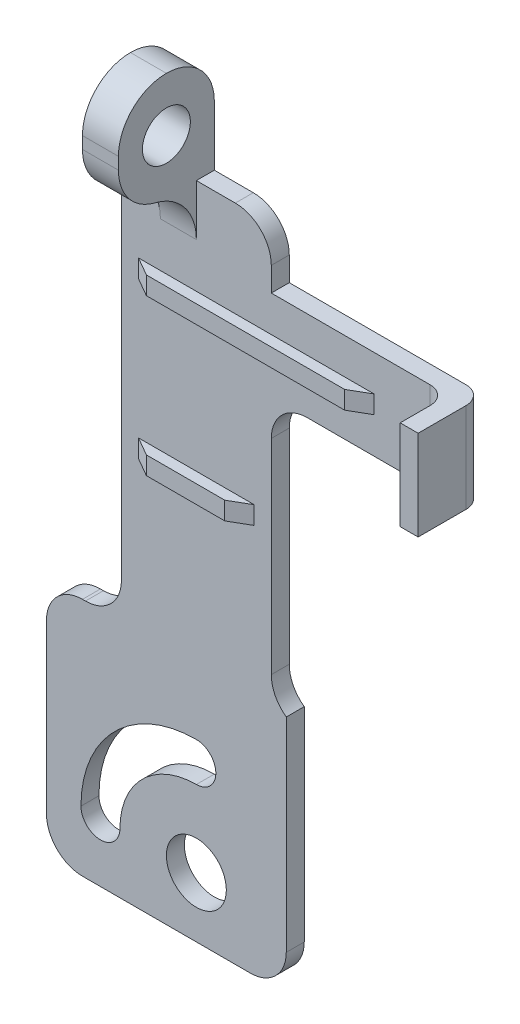
from build123d import *

# Parameters (mm, degrees)
BOSS_EXTRUDE1_DEPTH = 3
SKETCH4_R           = 5
CUT_EXTRUDE1_DEPTH  = 10.4
SKETCH7_W           = 6.5
SKETCH7_H           = 3
CUT_REVOLVE1_ANGLE  = 90
SKETCH8_R           = 3.25
CUT_EXTRUDE2_DEPTH  = 119.886500495
SKETCH9_W           = 16
SKETCH9_H           = 18
BOSS_EXTRUDE2_DEPTH = 6
SKETCH10_R          = 4
CUT_EXTRUDE3_DEPTH  = 8
FILLET1_R           = 8
FILLET2_R           = 9
SKETCH11_W          = 3
SKETCH11_H          = 15
BOSS_EXTRUDE3_DEPTH = 8
FILLET3_R           = 3
FILLET4_R           = 6
SKETCH12_W          = 40
SKETCH12_H          = 3
SKETCH12_W_2        = 20
BOSS_EXTRUDE4_DEPTH = 1.8
CHAMFER1_SIZE       = 2
CHAMFER1_SIZE_2     = 3.464101615


# Some blends are built 0.0001 mm under size
with BuildPart() as part:
    # Sketch1 → Boss-Extrude1 (new body)
    with BuildSketch(Plane.XY):
        Polygon((-12.5, 0), (-12.5, -70), (-25, -70), (-25, -110), (15, -110), (15, -70), (12.5, -70), (12.5, -25), (45, -25), (45, -10), (12.5, -10), (12.5, 0), (0, 0), align=None)
    extrude(amount=BOSS_EXTRUDE1_DEPTH)

    # Sketch4 → Cut-Extrude1 (cut)
    with BuildSketch(Plane.XY.offset(3)):
        with Locations((0, -100)):
            Circle(SKETCH4_R)
    extrude(amount=-CUT_EXTRUDE1_DEPTH, mode=Mode.SUBTRACT)

    # Sketch7 → Cut-Revolve1 (revolve, cut)
    with BuildSketch(Plane(origin=(0, -100, 0), x_dir=(1, 0, 0), z_dir=(0, 1, 0))):
        with Locations((-16, -1.5)):
            Rectangle(SKETCH7_W, SKETCH7_H)
    revolve(axis=Axis((0, -100, -80.99), (0, 0, -1)), revolution_arc=CUT_REVOLVE1_ANGLE, mode=Mode.SUBTRACT)

    # Sketch8 → Cut-Extrude2 (cut, through all)
    with BuildSketch(Plane.XY):
        with Locations((0, -84)):
            Circle(SKETCH8_R)
        with Locations((-16, -100)):
            Circle(SKETCH8_R)
    extrude(amount=CUT_EXTRUDE2_DEPTH, mode=Mode.SUBTRACT)

    # Sketch9 → Boss-Extrude2 (add)
    with BuildSketch(Plane(origin=(0, 0, 0), x_dir=(0, 0, -1), z_dir=(1, 0, 0))):
        with Locations((-8, 9)):
            Rectangle(SKETCH9_W, SKETCH9_H)
    extrude(amount=-BOSS_EXTRUDE2_DEPTH)

    # Sketch10 → Cut-Extrude3 (cut)
    with BuildSketch(Plane(origin=(0, 0, 0), x_dir=(0, 0, -1), z_dir=(1, 0, 0))):
        with Locations((-8, 9)):
            Circle(SKETCH10_R)
    extrude(amount=-CUT_EXTRUDE3_DEPTH, mode=Mode.SUBTRACT)

    # Fillet1
    fillet1_edges = [part.edges().sort_by_distance(p)[0] for p in [
        (-3, 0, 16),
        (-3, 18, 0),
        (-3, 18, 16),
    ]]
    fillet(fillet1_edges, radius=FILLET1_R - 0.0001)  # a hair under: the kernel refuses the full size

    # Fillet2
    # the kernel refuses this fillet: 9 mm, written as the material it adds along each edge
    with BuildSketch(Plane(origin=(-6, 0, 3), x_dir=(0, 0.032615873538584784, 0.9994679608638364), z_dir=(1, 0, 0))) as fillet2_piece_1:
        with BuildLine():
            CenterArc((8.717235267, 8.811741396), FILLET2_R, 181.869083386, 76.391304548)
            Line((-0.27797638, 8.518198535), (-1.177497545, 8.488844248))
            Line((-1.177497545, 8.488844248), (-0.899521165, -0.029354286))
            Line((-0.899521165, -0.029354286), (0.029354286, -0.899521165))
            ThreePointArc((0.029354286, -0.899521165), (5.026794037, -0.736438535), (6.702939259, -0.88117414))
            Line((6.702939259, -0.88117414), (6.886057078, 0))
        make_face()
    extrude(amount=6)

    # Sketch11 → Boss-Extrude3 (add)
    with BuildSketch(Plane.XY.offset(3)):
        with Locations((43.5, -17.5)):
            Rectangle(SKETCH11_W, SKETCH11_H)
    extrude(amount=BOSS_EXTRUDE3_DEPTH)

    # Fillet3
    fillet3_edges = [part.edges().sort_by_distance(p)[0] for p in [
        (42, -17.5, 3),
        (45, -17.5, 0),
    ]]
    fillet(fillet3_edges, radius=FILLET3_R)

    # Fillet4
    # the kernel refuses this fillet: 6 mm, written as the material it adds along each edge
    with BuildSketch(Plane(origin=(12.5, -25, 0), x_dir=(1, 0, 0), z_dir=(0, 0, 1))) as fillet4_piece_1:
        with BuildLine():
            CenterArc((FILLET4_R, -FILLET4_R), FILLET4_R, 90, 90)
            Line((0, -FILLET4_R), (0, 0))
            Line((0, 0), (FILLET4_R, 0))
        make_face()
    extrude(amount=3)
    with BuildSketch(Plane(origin=(12.5, -70, 0), x_dir=(0, 1, 0), z_dir=(0, 0, 1))) as fillet4_piece_2:
        with BuildLine():
            CenterArc((4.873397172, -6), FILLET4_R, 90, 54.314665287)
            Line((0, -2.5), (0, 0))
            Line((0, 0), (4.873397172, 0))
        make_face()
    extrude(amount=3)
    with BuildSketch(Plane(origin=(-12.5, -70, 0), x_dir=(0, 1, 0), z_dir=(0, 0, 1))) as fillet4_piece_3:
        with BuildLine():
            CenterArc((FILLET4_R, FILLET4_R), FILLET4_R, 180, 90)
            Line((0, FILLET4_R), (0, 0))
            Line((0, 0), (FILLET4_R, 0))
        make_face()
    extrude(amount=3)
    # the kernel refuses this fillet: 6 mm, written as the material it takes off along each edge
    with BuildSketch(Plane(origin=(15, -110, -15), x_dir=(0, 1, 0), z_dir=(0, 0, 1)), Plane(origin=(-25, -110, -15), x_dir=(1, 0, 0), z_dir=(0, 0, 1)), Plane(origin=(-25, -70, -15), x_dir=(0, -1, 0), z_dir=(0, 0, 1))) as fillet4_2_piece_1:
        with BuildLine():
            CenterArc((FILLET4_R, FILLET4_R), FILLET4_R, 180, 90)
            Line((0, FILLET4_R), (0, 0))
            Line((0, 0), (FILLET4_R, 0))
        make_face()
    extrude(amount=33, mode=Mode.SUBTRACT)
    with BuildSketch(Plane(origin=(-12.5, 0, -15), x_dir=(1, 0, 0), z_dir=(0, 0, 1)), Plane(origin=(12.5, 0, -15), x_dir=(0, -1, 0), z_dir=(0, 0, 1))) as fillet4_2_piece_2:
        with BuildLine():
            CenterArc((FILLET4_R, -FILLET4_R), FILLET4_R, 90, 90)
            Line((0, -FILLET4_R), (0, 0))
            Line((0, 0), (FILLET4_R, 0))
        make_face()
    extrude(amount=33, mode=Mode.SUBTRACT)

    # Sketch12 → Boss-Extrude4 (add)
    with BuildSketch(Plane.XY.offset(3)):
        with Locations((10, -17.5)):
            Rectangle(SKETCH12_W, SKETCH12_H)
        with Locations((0, -43.5)):
            Rectangle(SKETCH12_W_2, SKETCH12_H)
    extrude(amount=BOSS_EXTRUDE4_DEPTH)

    # Chamfer1
    # the kernel refuses this chamfer: 3.464101615, 2 mm, written as the material it takes off along each edge
    with BuildSketch(Plane(origin=(10, -53.961927941, 4.8), x_dir=(0, 0, -1), z_dir=(0, 1, 0))) as chamfer1_piece_1_section:
        Polygon((CHAMFER1_SIZE, 0), (0, CHAMFER1_SIZE_2), (0, 0), align=None)
    chamfer1_piece_1 = extrude(amount=20.923855882, mode=Mode.PRIVATE)
    chamfer1_piece_1 = split(chamfer1_piece_1, bisect_by=Plane(origin=(10, -53.961927941, 3), z_dir=(0, 0, 1)), keep=Keep.TOP, mode=Mode.PRIVATE)
    add(chamfer1_piece_1, mode=Mode.SUBTRACT)
    with BuildSketch(Plane(origin=(-10, -33.038072059, 4.8), x_dir=(0, 0, -1), z_dir=(0, -1, 0))) as chamfer1_piece_2_section:
        Polygon((CHAMFER1_SIZE, 0), (0, CHAMFER1_SIZE_2), (0, 0), align=None)
    chamfer1_piece_2 = extrude(amount=20.923855882, mode=Mode.PRIVATE)
    chamfer1_piece_2 = split(chamfer1_piece_2, bisect_by=Plane(origin=(-10, -33.038072059, 3), z_dir=(0, 0, 1)), keep=Keep.TOP, mode=Mode.PRIVATE)
    add(chamfer1_piece_2, mode=Mode.SUBTRACT)
    with BuildSketch(Plane(origin=(-10, -7.038072059, 4.8), x_dir=(0, 0, -1), z_dir=(0, -1, 0))) as chamfer1_piece_3_section:
        Polygon((CHAMFER1_SIZE, 0), (0, CHAMFER1_SIZE_2), (0, 0), align=None)
    chamfer1_piece_3 = extrude(amount=20.923855882, mode=Mode.PRIVATE)
    chamfer1_piece_3 = split(chamfer1_piece_3, bisect_by=Plane(origin=(-10, -7.038072059, 3), z_dir=(0, 0, 1)), keep=Keep.TOP, mode=Mode.PRIVATE)
    add(chamfer1_piece_3, mode=Mode.SUBTRACT)
    with BuildSketch(Plane(origin=(30, -27.961927941, 4.8), x_dir=(0, 0, -1), z_dir=(0, 1, 0))) as chamfer1_piece_4_section:
        Polygon((CHAMFER1_SIZE, 0), (0, CHAMFER1_SIZE_2), (0, 0), align=None)
    chamfer1_piece_4 = extrude(amount=20.923855882, mode=Mode.PRIVATE)
    chamfer1_piece_4 = split(chamfer1_piece_4, bisect_by=Plane(origin=(30, -27.961927941, 3), z_dir=(0, 0, 1)), keep=Keep.TOP, mode=Mode.PRIVATE)
    add(chamfer1_piece_4, mode=Mode.SUBTRACT)


solid = part.part
